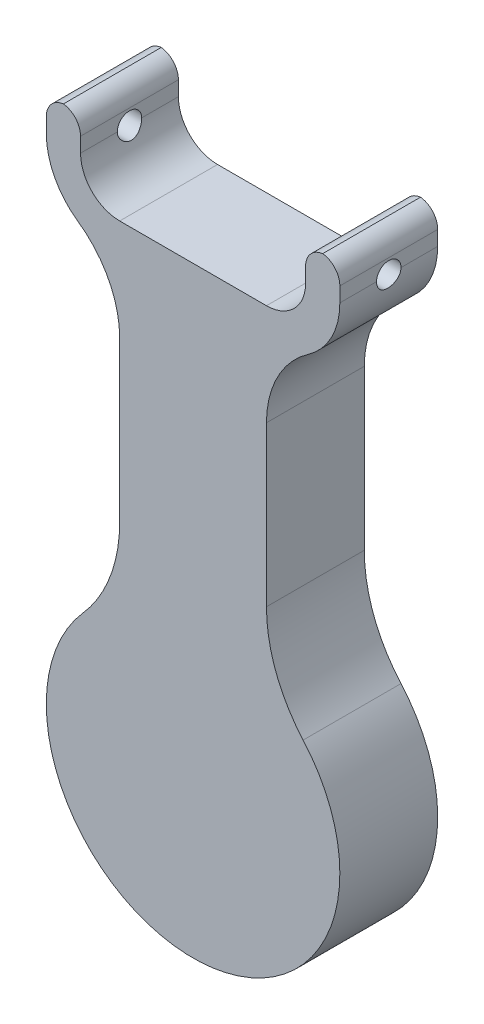
from build123d import *

# Parameters (mm, degrees)
SKETCH1_R               = 15
SKETCH1_R_2             = 3
BOSS_EXTRUDE1_DEPTH     = 10
SKETCH2_W               = 15
SKETCH2_H               = 30
BOSS_EXTRUDE2_DEPTH     = 10
FILLET1_R               = 15
SKETCH5_W               = 10
SKETCH5_H               = 2
BOSS_EXTRUDE3_DEPTH     = 10
BOSS_EXTRUDE4_START     = -3
SKETCH7_R               = 3
BOSS_EXTRUDE4_DEPTH     = 3
CHAMFER1_SIZE           = 0.7
BOSS_EXTRUDE6_DEPTH     = 10
FILLET4_R               = 2
FILLET2_R               = 10
CUT_EXTRUDE1_DEPTH      = 63.556116013
CUT_EXTRUDE1_DEPTH_BACK = 63.556116013
SKETCH10_R              = 1.25


with BuildPart() as part:
    # Sketch1 → Boss-Extrude1 (new body)
    with BuildSketch(Plane.XY):
        Circle(SKETCH1_R)
        Circle(SKETCH1_R_2, mode=Mode.SUBTRACT)
    extrude(amount=BOSS_EXTRUDE1_DEPTH)

    # Sketch2 → Boss-Extrude2 (add)
    with BuildSketch(Plane.XY):
        with Locations((0, 27.990381057)):
            Rectangle(SKETCH2_W, SKETCH2_H)
    extrude(amount=BOSS_EXTRUDE2_DEPTH)

    # Fillet1
    fillet1_edges = [part.edges().sort_by_distance(p)[0] for p in [
        (-7.5, 12.990381057, 5),
        (7.5, 12.990381057, 5),
    ]]
    fillet(fillet1_edges, radius=FILLET1_R)

    # Sketch5 → Boss-Extrude3 (add)
    with BuildSketch(Plane(origin=(0, 0, 0), x_dir=(-1, 0, 0), z_dir=(0, 0, -1))):
        with Locations((0, 2.5)):
            Rectangle(SKETCH5_W, SKETCH5_H)
    extrude(amount=-BOSS_EXTRUDE3_DEPTH)

    # Sketch7 → Boss-Extrude4 (add)
    with BuildSketch(Plane.XY.offset(10).offset(BOSS_EXTRUDE4_START)):
        Circle(SKETCH7_R)
    extrude(amount=BOSS_EXTRUDE4_DEPTH)

    # Chamfer1
    chamfer1_edges = [part.edges().sort_by_distance(p)[0] for p in [
        (0, 1.5, 7),
        (0, -3, 7),
    ]]
    chamfer(chamfer1_edges, length=CHAMFER1_SIZE)

    # Sketch9 → Boss-Extrude6 (add)
    with BuildSketch(Plane(origin=(0, 0, 0), x_dir=(-1, 0, 0), z_dir=(0, 0, -1))):
        with BuildLine():
            Line((-15, 53.990381057), (-15, 50.490381057))
            ThreePointArc((-15, 50.490381057), (-12.803300859, 45.187080198), (-7.5, 42.990381057))
            Line((-7.5, 42.990381057), (0, 42.990381057))
            Line((0, 42.990381057), (0, 46.490381057))
            Line((0, 46.490381057), (-7.5, 46.490381057))
            ThreePointArc((-7.5, 46.490381057), (-10.328427125, 47.661953932), (-11.5, 50.490381057))
            Line((-11.5, 50.490381057), (-11.5, 53.990381057))
            Line((-11.5, 53.990381057), (-15, 53.990381057))
        make_face()
        with BuildLine():
            Line((0, 46.490381057), (0, 42.990381057))
            Line((0, 42.990381057), (7.5, 42.990381057))
            ThreePointArc((7.5, 42.990381057), (12.803300859, 45.187080198), (15, 50.490381057))
            Line((15, 50.490381057), (15, 53.990381057))
            Line((15, 53.990381057), (11.5, 53.990381057))
            Line((11.5, 53.990381057), (11.5, 50.490381057))
            ThreePointArc((11.5, 50.490381057), (10.328427125, 47.661953932), (7.5, 46.490381057))
            Line((7.5, 46.490381057), (0, 46.490381057))
        make_face()
    extrude(amount=-BOSS_EXTRUDE6_DEPTH)

    # Fillet4
    # the kernel refuses this fillet: 2 mm, written as the material it takes off along each edge
    with BuildSketch(Plane(origin=(11.5, 53.990381057, -5), x_dir=(0, -1, 0), z_dir=(0, 0, 1)), Plane(origin=(15, 53.990381057, -5), x_dir=(-1, 0, 0), z_dir=(0, 0, 1)), Plane(origin=(-11.5, 53.990381057, -5), x_dir=(-1, 0, 0), z_dir=(0, 0, 1)), Plane(origin=(-15, 53.990381057, -5), x_dir=(0, -1, 0), z_dir=(0, 0, 1))) as fillet4_piece_1:
        with BuildLine():
            CenterArc((FILLET4_R, FILLET4_R), FILLET4_R, 180, 90)
            Line((0, FILLET4_R), (0, 0))
            Line((0, 0), (FILLET4_R, 0))
        make_face()
    extrude(amount=20, mode=Mode.SUBTRACT)

    # Fillet2
    fillet2_edges = [part.edges().sort_by_distance(p)[0] for p in [
        (-7.5, 42.990381057, 5),
        (7.5, 42.990381057, 5),
    ]]
    fillet(fillet2_edges, radius=FILLET2_R)

    # Sketch10 → Cut-Extrude1 (cut, two sides: drawn at the far end of the back side and taken through both)
    with BuildSketch(Plane(origin=(15, 0, 0), x_dir=(0, 0, -1), z_dir=(1, 0, 0)).offset(-CUT_EXTRUDE1_DEPTH_BACK)):
        with Locations((-5, 50.490381057)):
            Circle(SKETCH10_R)
    extrude(amount=CUT_EXTRUDE1_DEPTH + CUT_EXTRUDE1_DEPTH_BACK, mode=Mode.SUBTRACT)


solid = part.part
